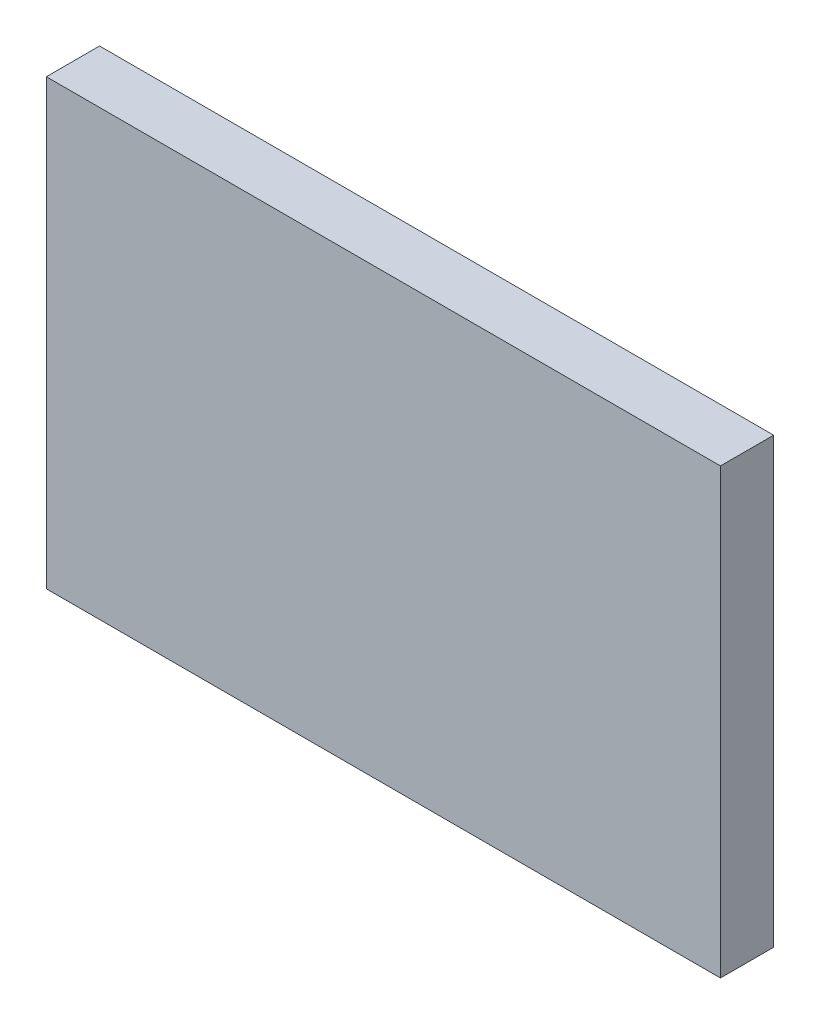
from build123d import *

# Parameters (mm, degrees)
SKETCH1_W           = 38
SKETCH1_H           = 25
BOSS_EXTRUDE1_DEPTH = 3


with BuildPart() as part:
    # Sketch1 → Boss-Extrude1 (new body)
    with BuildSketch(Plane.XY):
        with Locations((0, 35.478155345)):
            Rectangle(SKETCH1_W, SKETCH1_H)
    extrude(amount=BOSS_EXTRUDE1_DEPTH)


solid = part.part
